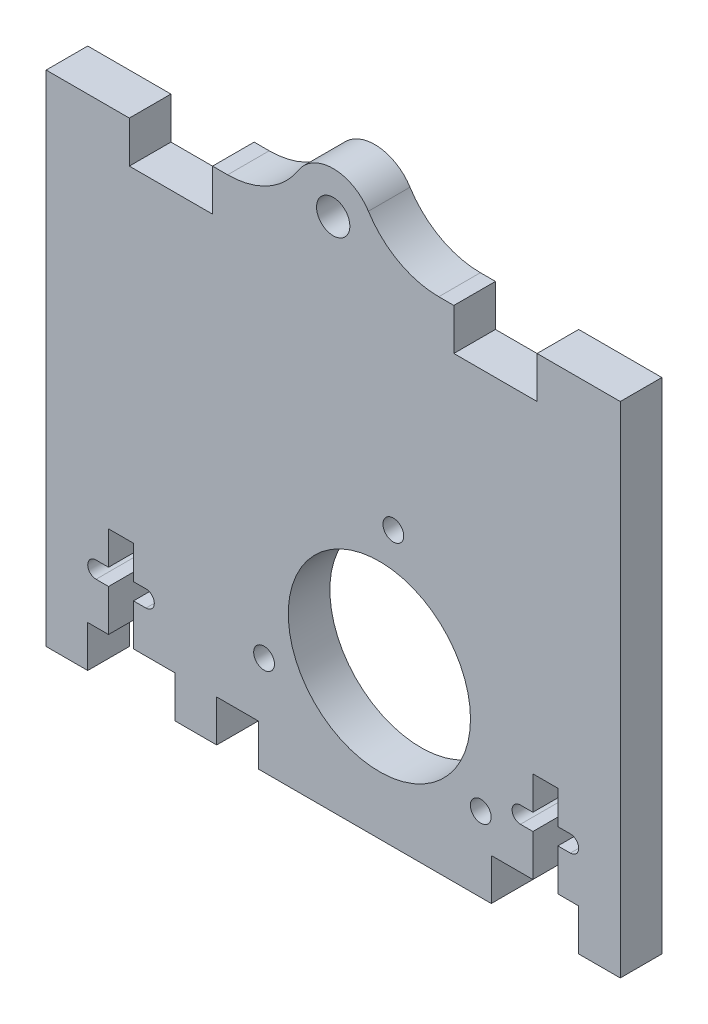
from build123d import *

# Parameters (mm, degrees)
SKETCH8_R           = 1.5
SKETCH8_R_2         = 7
SKETCH8_R_3         = 10.95
BOSS_EXTRUDE1_DEPTH = 5
SKETCH9_W           = 28
SKETCH9_H           = 5
SKETCH9_W_2         = 5
BOSS_EXTRUDE2_DEPTH = 5
BOSS_EXTRUDE3_DEPTH = 5
SKETCH11_R          = 5
SKETCH11_R_2        = 2
SKETCH11_W          = 10
SKETCH11_H          = 5
BOSS_EXTRUDE4_DEPTH = 5
SKETCH11_2_W        = 10
SKETCH11_2_H        = 5
CUT_EXTRUDE1_DEPTH  = 5
FILLET1_R           = 10
SKETCH12_R          = 1.25
CUT_EXTRUDE2_DEPTH  = 10


with BuildPart() as part:
    # Sketch8 → Boss-Extrude1 (new body)
    with BuildSketch(Plane.XY):
        with BuildLine():
            Line((-29.414037786, 30.725), (-29.414037786, -24.275))
            Line((-29.414037786, -24.275), (-21.914037786, -24.275))
            Line((-21.914037786, -24.275), (-21.914037786, -19.275))
            Line((-21.914037786, -19.275), (-23.414037786, -19.275))
            ThreePointArc((-23.414037786, -19.275), (-24.414037786, -18.275), (-23.414037786, -17.275))
            Line((-23.414037786, -17.275), (-21.914037786, -17.275))
            Line((-21.914037786, -17.275), (-21.914037786, -13.275))
            Line((-21.914037786, -13.275), (-18.914037786, -13.275))
            Line((-18.914037786, -13.275), (-18.914037786, -17.275))
            Line((-18.914037786, -17.275), (-17.414037786, -17.275))
            ThreePointArc((-17.414037786, -17.275), (-16.414037786, -18.275), (-17.414037786, -19.275))
            Line((-17.414037786, -19.275), (-18.914037786, -19.275))
            Line((-18.914037786, -19.275), (-18.914037786, -24.275))
            Line((-18.914037786, -24.275), (24.562751735, -24.275))
            Line((24.562751735, -24.275), (29.085962214, -24.275))
            Line((29.085962214, -24.275), (29.085962214, -19.275))
            Line((29.085962214, -19.275), (27.585962214, -19.275))
            ThreePointArc((27.585962214, -19.275), (26.585962214, -18.275), (27.585962214, -17.275))
            Line((27.585962214, -17.275), (29.085962214, -17.275))
            Line((29.085962214, -17.275), (29.085962214, -13.275))
            Line((29.085962214, -13.275), (32.085962214, -13.275))
            Line((32.085962214, -13.275), (32.085962214, -17.275))
            Line((32.085962214, -17.275), (33.585962214, -17.275))
            ThreePointArc((33.585962214, -17.275), (34.585962214, -18.275), (33.585962214, -19.275))
            Line((33.585962214, -19.275), (32.085962214, -19.275))
            Line((32.085962214, -19.275), (32.085962214, -24.275))
            Line((32.085962214, -24.275), (39.585962214, -24.275))
            Line((39.585962214, -24.275), (39.585962214, -9.275))
            ThreePointArc((39.585962214, -9.275), (27.870233462, 19.009271247), (-0.414037786, 30.725))
            Line((-0.414037786, 30.725), (-18.914037786, 30.725))
            Line((-18.914037786, 30.725), (-18.914037786, 25.725))
            Line((-18.914037786, 25.725), (-17.414037786, 25.725))
            ThreePointArc((-17.414037786, 25.725), (-16.414037786, 24.725), (-17.414037786, 23.725))
            Line((-17.414037786, 23.725), (-18.914037786, 23.725))
            Line((-18.914037786, 23.725), (-18.914037786, 19.725))
            Line((-18.914037786, 19.725), (-21.914037786, 19.725))
            Line((-21.914037786, 19.725), (-21.914037786, 23.725))
            Line((-21.914037786, 23.725), (-23.414037786, 23.725))
            ThreePointArc((-23.414037786, 23.725), (-24.414037786, 24.725), (-23.414037786, 25.725))
            Line((-23.414037786, 25.725), (-21.914037786, 25.725))
            Line((-21.914037786, 25.725), (-21.914037786, 30.725))
            Line((-21.914037786, 30.725), (-29.414037786, 30.725))
        make_face()
        with Locations((-8.585962214, -11.225)):
            Circle(SKETCH8_R, mode=Mode.SUBTRACT)
        with Locations((-21.085962214, 1.275)):
            Circle(SKETCH8_R, mode=Mode.SUBTRACT)
        with Locations((-8.585962214, 1.275)):
            Circle(SKETCH8_R_2, mode=Mode.SUBTRACT)
        with Locations((3.914037786, 1.275)):
            Circle(SKETCH8_R, mode=Mode.SUBTRACT)
        with Locations((10.635962214, -11.325)):
            Circle(SKETCH8_R_3, mode=Mode.SUBTRACT)
        with Locations((-8.585962214, 13.775)):
            Circle(SKETCH8_R, mode=Mode.SUBTRACT)
    extrude(amount=BOSS_EXTRUDE1_DEPTH)

    # Sketch9 → Boss-Extrude2 (add)
    with BuildSketch(Plane(origin=(0, 0, 0), x_dir=(-1, 0, 0), z_dir=(0, 0, -1))):
        with Locations((-10.085962214, -26.775)):
            Rectangle(SKETCH9_W, SKETCH9_H)
        with Locations((11.414037786, -26.775)):
            Rectangle(SKETCH9_W_2, SKETCH9_H)
        with Locations((-37.085962214, -26.775)):
            Rectangle(SKETCH9_W_2, SKETCH9_H)
        with BuildLine():
            Line((29.414037786, 30.725), (-39.585962214, 30.725))
            Line((-39.585962214, 30.725), (-39.585962214, 11.746641407))
            Line((-39.585962214, 11.746641407), (-39.585962214, -2.994966805))
            Line((-39.585962214, -2.994966805), (-39.585962214, -9.275))
            Line((-39.585962214, -9.275), (-26.161018226, -9.275))
            Line((-26.161018226, -9.275), (-26.161018226, -2.994966805))
            Line((-26.161018226, -2.994966805), (-17.743215339, -2.994966805))
            Line((-17.743215339, -2.994966805), (-17.743215339, 11.746641407))
            Line((-17.743215339, 11.746641407), (6.40967317, 11.746641407))
            ThreePointArc((6.40967317, 11.746641407), (8.585962214, 16.749974384), (10.762251258, 11.746641407))
            Line((10.762251258, 11.746641407), (29.414037786, 11.746641407))
            Line((29.414037786, 11.746641407), (29.414037786, 30.725))
        make_face()
        with Locations((26.914037786, -26.775)):
            Rectangle(SKETCH9_W_2, SKETCH9_H)
    extrude(amount=-BOSS_EXTRUDE2_DEPTH)

    # Sketch10 → Boss-Extrude3 (add)
    with BuildSketch(Plane(origin=(0, 0, 0), x_dir=(-1, 0, 0), z_dir=(0, 0, -1))):
        with BuildLine():
            ThreePointArc((0.24244604, -12.575093539), (22.108734215, 10.139197122), (-7.442753561, -0.850940687))
            ThreePointArc((-7.442753561, -0.850940687), (-1.478094524, -5.322004133), (0.24244604, -12.575093539))
        make_face()
    extrude(amount=-BOSS_EXTRUDE3_DEPTH)

    # Sketch11 → Boss-Extrude4 (add)
    # profile 1 of 3: a face of its own
    with BuildSketch(Plane.XY.offset(5)):
        with Locations((5.085962214, 32.725)):
            Circle(SKETCH11_R)
        with Locations((5.085962214, 32.725)):
            Circle(SKETCH11_R_2, mode=Mode.SUBTRACT)
    # profile 2 of 3: a face of its own
    with BuildSketch(Plane.XY.offset(5)):
        with Locations((-14.414037786, 28.225)):
            Rectangle(SKETCH11_W, SKETCH11_H)
    # profile 3 of 3: a face of its own
    with BuildSketch(Plane.XY.offset(5)):
        with Locations((24.585962214, 28.225)):
            Rectangle(SKETCH11_W, SKETCH11_H)
    extrude(amount=-BOSS_EXTRUDE4_DEPTH)

    # Sketch11<2> → Cut-Extrude1 (cut)
    with BuildSketch(Plane.XY.offset(5)):
        with Locations((24.585962214, 28.225)):
            Rectangle(SKETCH11_2_W, SKETCH11_2_H)
        with Locations((-14.414037786, 28.225)):
            Rectangle(SKETCH11_2_W, SKETCH11_2_H)
    extrude(amount=-CUT_EXTRUDE1_DEPTH, mode=Mode.SUBTRACT)

    # Fillet1
    fillet1_edges = [part.edges().sort_by_distance(p)[0] for p in [
        (9.668537909, 30.725, 2.5),
        (0.503386519, 30.725, 2.5),
    ]]
    fillet(fillet1_edges, radius=FILLET1_R)

    # Sketch12 → Cut-Extrude2 (cut)
    with BuildSketch(Plane.XY.offset(5)):
        with Locations((22.818089077, -20.294210774)):
            Circle(SKETCH12_R)
        with Locations((-3.222665599, -17.390425948)):
            Circle(SKETCH12_R)
        with Locations((12.312463165, 3.709636722)):
            Circle(SKETCH12_R)
    extrude(amount=-CUT_EXTRUDE2_DEPTH, mode=Mode.SUBTRACT)


solid = part.part
